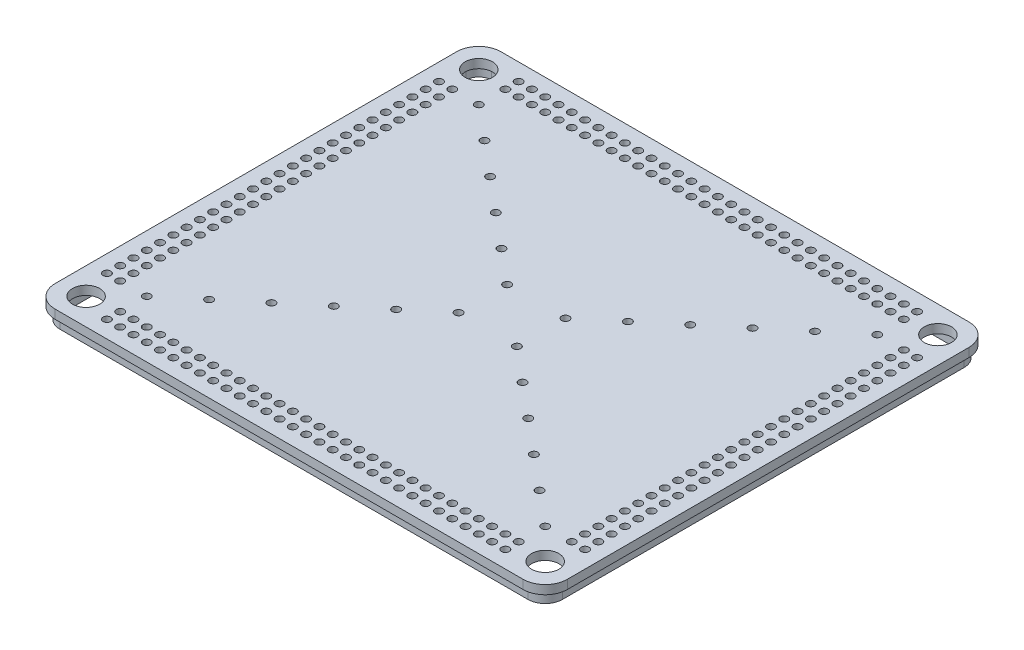
from build123d import *

# Parameters (mm, degrees)
SKETCH1_W               = 231.4
SKETCH1_H               = 201.4
BOSS_EXTRUDE1_DEPTH     = 4
FILLET1_R               = 10
SKETCH2_R               = 6.15
CUT_EXTRUDE1_DEPTH      = 5
MIRROR2_COPY_1_SKETCH_R = 6.15
MIRROR2_COPY_1_DEPTH    = 5
CUT_EXTRUDE2_OUTLINE_R  = 1.75
CUT_EXTRUDE2_DEPTH      = 4
BOSS_EXTRUDE2_DEPTH     = 5
SKETCH6_R               = 1.75
CUT_EXTRUDE4_DEPTH      = 5
SKETCH7_R               = 1.75
CUT_EXTRUDE5_DEPTH      = 10
SKETCH8_R               = 1.75
CUT_EXTRUDE6_DEPTH      = 10


# Read off the part's stored shape, not the designer's step: Cut-Extrude2
with BuildPart() as part:
    # Sketch1 → Boss-Extrude1 (new body)
    with BuildSketch(Plane(origin=(0, 0, 0), x_dir=(1, 0, 0), z_dir=(0, 1, 0))):
        Rectangle(SKETCH1_W, SKETCH1_H)
    extrude(amount=BOSS_EXTRUDE1_DEPTH)

    # Fillet1
    fillet1_edges = [part.edges().sort_by_distance(p)[0] for p in [
        (-115.7, 2, -100.7),
        (115.7, 2, -100.7),
        (115.7, 2, 100.7),
        (-115.7, 2, 100.7),
    ]]
    fillet(fillet1_edges, radius=FILLET1_R)

    # Sketch2 → Cut-Extrude1 (cut)
    with BuildSketch(Plane(origin=(0, 4, 0), x_dir=(1, 0, 0), z_dir=(0, 1, 0))):
        with Locations(Location((-103.7, 88.7, 0), (0, 0, 270))):
            Circle(SKETCH2_R)
    cut_extrude1 = extrude(amount=-CUT_EXTRUDE1_DEPTH, mode=Mode.SUBTRACT)

    # Mirror1: Cut-Extrude1 across plane
    add(cut_extrude1.mirror(Plane(origin=(0, 0, 0), x_dir=(0, 0, 1), z_dir=(1, 0, 0))), mode=Mode.SUBTRACT)

    # Mirror2: Cut-Extrude1 across plane
    add(cut_extrude1.mirror(Plane.XY), mode=Mode.SUBTRACT)

    # Mirror2 copy 1 sketch → Mirror2 copy 1 (cut)
    with BuildSketch(Plane(origin=(0, 4, 0), x_dir=(-1, 0, 0), z_dir=(0, 1, 0))):
        with Locations(Location((-103.7, 88.7, 0), (0, 0, 270))):
            Circle(MIRROR2_COPY_1_SKETCH_R)
    extrude(amount=-MIRROR2_COPY_1_DEPTH, mode=Mode.SUBTRACT)

    # Cut-Extrude2 outline → Cut-Extrude2 (cut)
    with BuildSketch(Plane(origin=(0, 0, 0), x_dir=(1, 0, 0), z_dir=(0, 1, 0))):
        with Locations((-90, 93)):
            Circle(CUT_EXTRUDE2_OUTLINE_R)
        with Locations((24, -93)):
            Circle(CUT_EXTRUDE2_OUTLINE_R)
        with Locations((18, -93)):
            Circle(CUT_EXTRUDE2_OUTLINE_R)
        with Locations((12, -93)):
            Circle(CUT_EXTRUDE2_OUTLINE_R)
        with Locations((6, -93)):
            Circle(CUT_EXTRUDE2_OUTLINE_R)
        with Locations((0, -93)):
            Circle(CUT_EXTRUDE2_OUTLINE_R)
        with Locations((-6, -93)):
            Circle(CUT_EXTRUDE2_OUTLINE_R)
        with Locations((-12, -93)):
            Circle(CUT_EXTRUDE2_OUTLINE_R)
        with Locations((-18, -93)):
            Circle(CUT_EXTRUDE2_OUTLINE_R)
        with Locations((-24, -93)):
            Circle(CUT_EXTRUDE2_OUTLINE_R)
        with Locations((-30, -93)):
            Circle(CUT_EXTRUDE2_OUTLINE_R)
        with Locations((-36, -93)):
            Circle(CUT_EXTRUDE2_OUTLINE_R)
        with Locations((-42, -93)):
            Circle(CUT_EXTRUDE2_OUTLINE_R)
        with Locations((-48, -93)):
            Circle(CUT_EXTRUDE2_OUTLINE_R)
        with Locations((-54, -93)):
            Circle(CUT_EXTRUDE2_OUTLINE_R)
        with Locations((-60, -93)):
            Circle(CUT_EXTRUDE2_OUTLINE_R)
        with Locations((-66, -93)):
            Circle(CUT_EXTRUDE2_OUTLINE_R)
        with Locations((-6, -87)):
            Circle(CUT_EXTRUDE2_OUTLINE_R)
        with Locations((0, -87)):
            Circle(CUT_EXTRUDE2_OUTLINE_R)
        with Locations((6, -87)):
            Circle(CUT_EXTRUDE2_OUTLINE_R)
        with Locations((12, -87)):
            Circle(CUT_EXTRUDE2_OUTLINE_R)
        with Locations((18, -87)):
            Circle(CUT_EXTRUDE2_OUTLINE_R)
        with Locations((24, -87)):
            Circle(CUT_EXTRUDE2_OUTLINE_R)
        with Locations((30, -87)):
            Circle(CUT_EXTRUDE2_OUTLINE_R)
        with Locations((36, -87)):
            Circle(CUT_EXTRUDE2_OUTLINE_R)
        with Locations((42, -87)):
            Circle(CUT_EXTRUDE2_OUTLINE_R)
        with Locations((48, -87)):
            Circle(CUT_EXTRUDE2_OUTLINE_R)
        with Locations((54, -87)):
            Circle(CUT_EXTRUDE2_OUTLINE_R)
        with Locations((60, -87)):
            Circle(CUT_EXTRUDE2_OUTLINE_R)
        with Locations((-90, -87)):
            Circle(CUT_EXTRUDE2_OUTLINE_R)
        with Locations((-84, -93)):
            Circle(CUT_EXTRUDE2_OUTLINE_R)
        with Locations((-78, -93)):
            Circle(CUT_EXTRUDE2_OUTLINE_R)
        with Locations((-72, -93)):
            Circle(CUT_EXTRUDE2_OUTLINE_R)
        with Locations((84, 87)):
            Circle(CUT_EXTRUDE2_OUTLINE_R)
        with Locations((84, -87)):
            Circle(CUT_EXTRUDE2_OUTLINE_R)
        with Locations((84, -93)):
            Circle(CUT_EXTRUDE2_OUTLINE_R)
        with Locations((90, 93)):
            Circle(CUT_EXTRUDE2_OUTLINE_R)
        with Locations((78, 87)):
            Circle(CUT_EXTRUDE2_OUTLINE_R)
        with Locations((78, -87)):
            Circle(CUT_EXTRUDE2_OUTLINE_R)
        with Locations((78, -93)):
            Circle(CUT_EXTRUDE2_OUTLINE_R)
        with Locations((84, 93)):
            Circle(CUT_EXTRUDE2_OUTLINE_R)
        with Locations((90, 87)):
            Circle(CUT_EXTRUDE2_OUTLINE_R)
        with Locations((90, -87)):
            Circle(CUT_EXTRUDE2_OUTLINE_R)
        with Locations((90, -93)):
            Circle(CUT_EXTRUDE2_OUTLINE_R)
        with Locations((54, -93)):
            Circle(CUT_EXTRUDE2_OUTLINE_R)
        with Locations((60, -93)):
            Circle(CUT_EXTRUDE2_OUTLINE_R)
        with Locations((-90, -93)):
            Circle(CUT_EXTRUDE2_OUTLINE_R)
        with Locations((66, 93)):
            Circle(CUT_EXTRUDE2_OUTLINE_R)
        with Locations((48, -93)):
            Circle(CUT_EXTRUDE2_OUTLINE_R)
        with Locations((42, -93)):
            Circle(CUT_EXTRUDE2_OUTLINE_R)
        with Locations((36, -93)):
            Circle(CUT_EXTRUDE2_OUTLINE_R)
        with Locations((30, -93)):
            Circle(CUT_EXTRUDE2_OUTLINE_R)
        with Locations((72, 87)):
            Circle(CUT_EXTRUDE2_OUTLINE_R)
        with Locations((72, -87)):
            Circle(CUT_EXTRUDE2_OUTLINE_R)
        with Locations((72, -93)):
            Circle(CUT_EXTRUDE2_OUTLINE_R)
        with Locations((78, 93)):
            Circle(CUT_EXTRUDE2_OUTLINE_R)
        with Locations((66, 87)):
            Circle(CUT_EXTRUDE2_OUTLINE_R)
        with Locations((66, -87)):
            Circle(CUT_EXTRUDE2_OUTLINE_R)
        with Locations((66, -93)):
            Circle(CUT_EXTRUDE2_OUTLINE_R)
        with Locations((72, 93)):
            Circle(CUT_EXTRUDE2_OUTLINE_R)
        with Locations((-42, 87)):
            Circle(CUT_EXTRUDE2_OUTLINE_R)
        with Locations((-48, 87)):
            Circle(CUT_EXTRUDE2_OUTLINE_R)
        with Locations((-54, 87)):
            Circle(CUT_EXTRUDE2_OUTLINE_R)
        with Locations((-60, 87)):
            Circle(CUT_EXTRUDE2_OUTLINE_R)
        with Locations((-66, 87)):
            Circle(CUT_EXTRUDE2_OUTLINE_R)
        with Locations((-72, 87)):
            Circle(CUT_EXTRUDE2_OUTLINE_R)
        with Locations((-78, 87)):
            Circle(CUT_EXTRUDE2_OUTLINE_R)
        with Locations((-84, 87)):
            Circle(CUT_EXTRUDE2_OUTLINE_R)
        with Locations((54, 93)):
            Circle(CUT_EXTRUDE2_OUTLINE_R)
        with Locations((48, 93)):
            Circle(CUT_EXTRUDE2_OUTLINE_R)
        with Locations((42, 93)):
            Circle(CUT_EXTRUDE2_OUTLINE_R)
        with Locations((36, 93)):
            Circle(CUT_EXTRUDE2_OUTLINE_R)
        with Locations((30, 93)):
            Circle(CUT_EXTRUDE2_OUTLINE_R)
        with Locations((24, 93)):
            Circle(CUT_EXTRUDE2_OUTLINE_R)
        with Locations((18, 93)):
            Circle(CUT_EXTRUDE2_OUTLINE_R)
        with Locations((12, 93)):
            Circle(CUT_EXTRUDE2_OUTLINE_R)
        with Locations((6, 93)):
            Circle(CUT_EXTRUDE2_OUTLINE_R)
        with Locations((0, 93)):
            Circle(CUT_EXTRUDE2_OUTLINE_R)
        with Locations((-6, 93)):
            Circle(CUT_EXTRUDE2_OUTLINE_R)
        with Locations((-12, 93)):
            Circle(CUT_EXTRUDE2_OUTLINE_R)
        with Locations((-18, 93)):
            Circle(CUT_EXTRUDE2_OUTLINE_R)
        with Locations((-24, 93)):
            Circle(CUT_EXTRUDE2_OUTLINE_R)
        with Locations((-30, 93)):
            Circle(CUT_EXTRUDE2_OUTLINE_R)
        with Locations((-36, 93)):
            Circle(CUT_EXTRUDE2_OUTLINE_R)
        with Locations((-42, 93)):
            Circle(CUT_EXTRUDE2_OUTLINE_R)
        with Locations((-48, 93)):
            Circle(CUT_EXTRUDE2_OUTLINE_R)
        with Locations((-54, 93)):
            Circle(CUT_EXTRUDE2_OUTLINE_R)
        with Locations((-60, 93)):
            Circle(CUT_EXTRUDE2_OUTLINE_R)
        with Locations((-66, 93)):
            Circle(CUT_EXTRUDE2_OUTLINE_R)
        with Locations((-72, 93)):
            Circle(CUT_EXTRUDE2_OUTLINE_R)
        with Locations((-78, 93)):
            Circle(CUT_EXTRUDE2_OUTLINE_R)
        with Locations((-84, 93)):
            Circle(CUT_EXTRUDE2_OUTLINE_R)
        with Locations((-60, -87)):
            Circle(CUT_EXTRUDE2_OUTLINE_R)
        with Locations((-66, -87)):
            Circle(CUT_EXTRUDE2_OUTLINE_R)
        with Locations((-72, -87)):
            Circle(CUT_EXTRUDE2_OUTLINE_R)
        with Locations((-78, -87)):
            Circle(CUT_EXTRUDE2_OUTLINE_R)
        with Locations((-84, -87)):
            Circle(CUT_EXTRUDE2_OUTLINE_R)
        with Locations((-90, 87)):
            Circle(CUT_EXTRUDE2_OUTLINE_R)
        with Locations((60, 87)):
            Circle(CUT_EXTRUDE2_OUTLINE_R)
        with Locations((60, 93)):
            Circle(CUT_EXTRUDE2_OUTLINE_R)
        with Locations((-54, -87)):
            Circle(CUT_EXTRUDE2_OUTLINE_R)
        with Locations((-48, -87)):
            Circle(CUT_EXTRUDE2_OUTLINE_R)
        with Locations((-42, -87)):
            Circle(CUT_EXTRUDE2_OUTLINE_R)
        with Locations((-36, -87)):
            Circle(CUT_EXTRUDE2_OUTLINE_R)
        with Locations((-30, -87)):
            Circle(CUT_EXTRUDE2_OUTLINE_R)
        with Locations((-24, -87)):
            Circle(CUT_EXTRUDE2_OUTLINE_R)
        with Locations((-18, -87)):
            Circle(CUT_EXTRUDE2_OUTLINE_R)
        with Locations((-12, -87)):
            Circle(CUT_EXTRUDE2_OUTLINE_R)
        with Locations((54, 87)):
            Circle(CUT_EXTRUDE2_OUTLINE_R)
        with Locations((48, 87)):
            Circle(CUT_EXTRUDE2_OUTLINE_R)
        with Locations((42, 87)):
            Circle(CUT_EXTRUDE2_OUTLINE_R)
        with Locations((36, 87)):
            Circle(CUT_EXTRUDE2_OUTLINE_R)
        with Locations((30, 87)):
            Circle(CUT_EXTRUDE2_OUTLINE_R)
        with Locations((24, 87)):
            Circle(CUT_EXTRUDE2_OUTLINE_R)
        with Locations((18, 87)):
            Circle(CUT_EXTRUDE2_OUTLINE_R)
        with Locations((12, 87)):
            Circle(CUT_EXTRUDE2_OUTLINE_R)
        with Locations((6, 87)):
            Circle(CUT_EXTRUDE2_OUTLINE_R)
        with Locations((0, 87)):
            Circle(CUT_EXTRUDE2_OUTLINE_R)
        with Locations((-6, 87)):
            Circle(CUT_EXTRUDE2_OUTLINE_R)
        with Locations((-12, 87)):
            Circle(CUT_EXTRUDE2_OUTLINE_R)
        with Locations((-18, 87)):
            Circle(CUT_EXTRUDE2_OUTLINE_R)
        with Locations((-24, 87)):
            Circle(CUT_EXTRUDE2_OUTLINE_R)
        with Locations((-30, 87)):
            Circle(CUT_EXTRUDE2_OUTLINE_R)
        with Locations((-36, 87)):
            Circle(CUT_EXTRUDE2_OUTLINE_R)
    extrude(amount=CUT_EXTRUDE2_DEPTH, mode=Mode.SUBTRACT)

    # Sketch5 → Boss-Extrude2 (add)
    with BuildSketch(Plane.XZ):
        with BuildLine():
            Line((-105.7, -98.5), (105.7, -98.5))
            ThreePointArc((105.7, -98.5), (111.215432893, -96.215432893), (113.5, -90.7))
            Line((113.5, -90.7), (113.5, 90.7))
            ThreePointArc((113.5, 90.7), (111.215432893, 96.215432893), (105.7, 98.5))
            Line((105.7, 98.5), (-105.7, 98.5))
            ThreePointArc((-105.7, 98.5), (-111.215432893, 96.215432893), (-113.5, 90.7))
            Line((-113.5, 90.7), (-113.5, -90.7))
            ThreePointArc((-113.5, -90.7), (-111.215432893, -96.215432893), (-105.7, -98.5))
        make_face()
        with BuildLine():
            Line((-105.7, -96.5), (105.7, -96.5))
            ThreePointArc((105.7, -96.5), (109.801219331, -94.801219331), (111.5, -90.7))
            Line((111.5, -90.7), (111.5, 90.7))
            ThreePointArc((111.5, 90.7), (109.801219331, 94.801219331), (105.7, 96.5))
            Line((105.7, 96.5), (-105.7, 96.5))
            ThreePointArc((-105.7, 96.5), (-109.801219331, 94.801219331), (-111.5, 90.7))
            Line((-111.5, 90.7), (-111.5, -90.7))
            ThreePointArc((-111.5, -90.7), (-109.801219331, -94.801219331), (-105.7, -96.5))
        make_face(mode=Mode.SUBTRACT)
    extrude(amount=BOSS_EXTRUDE2_DEPTH)

    # Sketch6 → Cut-Extrude4 (cut)
    with BuildSketch(Plane(origin=(0, 4, 0), x_dir=(1, 0, 0), z_dir=(0, 1, 0))):
        with Locations(Location((-102, 75, 0), (0, 0, 270))):
            Circle(SKETCH6_R)
        with Locations(Location((-108, 75, 0), (0, 0, 270))):
            Circle(SKETCH6_R)
        with Locations(Location((-102, 69, 0), (0, 0, 270))):
            Circle(SKETCH6_R)
        with Locations(Location((-108, 69, 0), (0, 0, 270))):
            Circle(SKETCH6_R)
        with Locations(Location((-102, 63, 0), (0, 0, 270))):
            Circle(SKETCH6_R)
        with Locations(Location((-108, 63, 0), (0, 0, 270))):
            Circle(SKETCH6_R)
        with Locations(Location((-102, 57, 0), (0, 0, 270))):
            Circle(SKETCH6_R)
        with Locations(Location((-108, 57, 0), (0, 0, 270))):
            Circle(SKETCH6_R)
        with Locations(Location((-102, 51, 0), (0, 0, 270))):
            Circle(SKETCH6_R)
        with Locations(Location((-108, 51, 0), (0, 0, 270))):
            Circle(SKETCH6_R)
        with Locations(Location((-102, 45, 0), (0, 0, 270))):
            Circle(SKETCH6_R)
        with Locations(Location((-108, 45, 0), (0, 0, 270))):
            Circle(SKETCH6_R)
        with Locations(Location((-102, 39, 0), (0, 0, 270))):
            Circle(SKETCH6_R)
        with Locations(Location((-108, 39, 0), (0, 0, 270))):
            Circle(SKETCH6_R)
        with Locations(Location((-102, 33, 0), (0, 0, 270))):
            Circle(SKETCH6_R)
        with Locations(Location((-108, 33, 0), (0, 0, 270))):
            Circle(SKETCH6_R)
        with Locations(Location((-102, 27, 0), (0, 0, 270))):
            Circle(SKETCH6_R)
        with Locations(Location((-108, 27, 0), (0, 0, 270))):
            Circle(SKETCH6_R)
        with Locations(Location((-102, 21, 0), (0, 0, 270))):
            Circle(SKETCH6_R)
        with Locations(Location((-108, 21, 0), (0, 0, 270))):
            Circle(SKETCH6_R)
        with Locations(Location((-102, 15, 0), (0, 0, 270))):
            Circle(SKETCH6_R)
        with Locations(Location((-108, 15, 0), (0, 0, 270))):
            Circle(SKETCH6_R)
        with Locations(Location((-102, 9, 0), (0, 0, 270))):
            Circle(SKETCH6_R)
        with Locations(Location((-108, 9, 0), (0, 0, 270))):
            Circle(SKETCH6_R)
        with Locations(Location((-102, 3, 0), (0, 0, 270))):
            Circle(SKETCH6_R)
        with Locations(Location((-108, 3, 0), (0, 0, 270))):
            Circle(SKETCH6_R)
        with Locations(Location((-102, -3, 0), (0, 0, 270))):
            Circle(SKETCH6_R)
        with Locations(Location((-108, -3, 0), (0, 0, 270))):
            Circle(SKETCH6_R)
        with Locations(Location((-102, -9, 0), (0, 0, 270))):
            Circle(SKETCH6_R)
        with Locations(Location((-108, -9, 0), (0, 0, 270))):
            Circle(SKETCH6_R)
        with Locations(Location((-102, -15, 0), (0, 0, 270))):
            Circle(SKETCH6_R)
        with Locations(Location((-108, -15, 0), (0, 0, 270))):
            Circle(SKETCH6_R)
        with Locations(Location((-102, -21, 0), (0, 0, 270))):
            Circle(SKETCH6_R)
        with Locations(Location((-108, -21, 0), (0, 0, 270))):
            Circle(SKETCH6_R)
        with Locations(Location((-102, -27, 0), (0, 0, 270))):
            Circle(SKETCH6_R)
        with Locations(Location((-108, -27, 0), (0, 0, 270))):
            Circle(SKETCH6_R)
        with Locations(Location((-102, -33, 0), (0, 0, 270))):
            Circle(SKETCH6_R)
        with Locations(Location((-108, -33, 0), (0, 0, 270))):
            Circle(SKETCH6_R)
        with Locations(Location((-102, -39, 0), (0, 0, 270))):
            Circle(SKETCH6_R)
        with Locations(Location((-108, -39, 0), (0, 0, 270))):
            Circle(SKETCH6_R)
        with Locations(Location((-102, -45, 0), (0, 0, 270))):
            Circle(SKETCH6_R)
        with Locations(Location((-108, -45, 0), (0, 0, 270))):
            Circle(SKETCH6_R)
        with Locations(Location((-102, -51, 0), (0, 0, 270))):
            Circle(SKETCH6_R)
        with Locations(Location((-108, -51, 0), (0, 0, 270))):
            Circle(SKETCH6_R)
        with Locations(Location((-102, -57, 0), (0, 0, 270))):
            Circle(SKETCH6_R)
        with Locations(Location((-108, -57, 0), (0, 0, 270))):
            Circle(SKETCH6_R)
        with Locations(Location((-102, -63, 0), (0, 0, 270))):
            Circle(SKETCH6_R)
        with Locations(Location((-108, -63, 0), (0, 0, 270))):
            Circle(SKETCH6_R)
        with Locations(Location((-102, -69, 0), (0, 0, 270))):
            Circle(SKETCH6_R)
        with Locations(Location((-108, -69, 0), (0, 0, 270))):
            Circle(SKETCH6_R)
        with Locations(Location((-102, -75, 0), (0, 0, 270))):
            Circle(SKETCH6_R)
        with Locations(Location((-108, -75, 0), (0, 0, 270))):
            Circle(SKETCH6_R)
        with Locations(Location((108, -75, 0), (0, 0, 270))):
            Circle(SKETCH6_R)
        with Locations(Location((102, -75, 0), (0, 0, 270))):
            Circle(SKETCH6_R)
        with Locations(Location((108, -69, 0), (0, 0, 270))):
            Circle(SKETCH6_R)
        with Locations(Location((102, -69, 0), (0, 0, 270))):
            Circle(SKETCH6_R)
        with Locations(Location((108, -63, 0), (0, 0, 270))):
            Circle(SKETCH6_R)
        with Locations(Location((102, -63, 0), (0, 0, 270))):
            Circle(SKETCH6_R)
        with Locations(Location((108, -57, 0), (0, 0, 270))):
            Circle(SKETCH6_R)
        with Locations(Location((102, -57, 0), (0, 0, 270))):
            Circle(SKETCH6_R)
        with Locations(Location((108, -51, 0), (0, 0, 270))):
            Circle(SKETCH6_R)
        with Locations(Location((102, -51, 0), (0, 0, 270))):
            Circle(SKETCH6_R)
        with Locations(Location((108, -45, 0), (0, 0, 270))):
            Circle(SKETCH6_R)
        with Locations(Location((102, -45, 0), (0, 0, 270))):
            Circle(SKETCH6_R)
        with Locations(Location((108, -39, 0), (0, 0, 270))):
            Circle(SKETCH6_R)
        with Locations(Location((102, -39, 0), (0, 0, 270))):
            Circle(SKETCH6_R)
        with Locations(Location((108, -33, 0), (0, 0, 270))):
            Circle(SKETCH6_R)
        with Locations(Location((102, -33, 0), (0, 0, 270))):
            Circle(SKETCH6_R)
        with Locations(Location((108, -27, 0), (0, 0, 270))):
            Circle(SKETCH6_R)
        with Locations(Location((102, -27, 0), (0, 0, 270))):
            Circle(SKETCH6_R)
        with Locations(Location((108, -21, 0), (0, 0, 270))):
            Circle(SKETCH6_R)
        with Locations(Location((102, -21, 0), (0, 0, 270))):
            Circle(SKETCH6_R)
        with Locations(Location((108, -15, 0), (0, 0, 270))):
            Circle(SKETCH6_R)
        with Locations(Location((102, -15, 0), (0, 0, 270))):
            Circle(SKETCH6_R)
        with Locations(Location((108, -9, 0), (0, 0, 270))):
            Circle(SKETCH6_R)
        with Locations(Location((102, -9, 0), (0, 0, 270))):
            Circle(SKETCH6_R)
        with Locations(Location((108, -3, 0), (0, 0, 270))):
            Circle(SKETCH6_R)
        with Locations(Location((102, -3, 0), (0, 0, 270))):
            Circle(SKETCH6_R)
        with Locations(Location((108, 3, 0), (0, 0, 270))):
            Circle(SKETCH6_R)
        with Locations(Location((102, 3, 0), (0, 0, 270))):
            Circle(SKETCH6_R)
        with Locations(Location((108, 9, 0), (0, 0, 270))):
            Circle(SKETCH6_R)
        with Locations(Location((102, 9, 0), (0, 0, 270))):
            Circle(SKETCH6_R)
        with Locations(Location((108, 15, 0), (0, 0, 270))):
            Circle(SKETCH6_R)
        with Locations(Location((102, 15, 0), (0, 0, 270))):
            Circle(SKETCH6_R)
        with Locations(Location((108, 21, 0), (0, 0, 270))):
            Circle(SKETCH6_R)
        with Locations(Location((102, 21, 0), (0, 0, 270))):
            Circle(SKETCH6_R)
        with Locations(Location((108, 27, 0), (0, 0, 270))):
            Circle(SKETCH6_R)
        with Locations(Location((102, 27, 0), (0, 0, 270))):
            Circle(SKETCH6_R)
        with Locations(Location((108, 33, 0), (0, 0, 270))):
            Circle(SKETCH6_R)
        with Locations(Location((102, 33, 0), (0, 0, 270))):
            Circle(SKETCH6_R)
        with Locations(Location((108, 39, 0), (0, 0, 270))):
            Circle(SKETCH6_R)
        with Locations(Location((102, 39, 0), (0, 0, 270))):
            Circle(SKETCH6_R)
        with Locations(Location((108, 45, 0), (0, 0, 270))):
            Circle(SKETCH6_R)
        with Locations(Location((102, 45, 0), (0, 0, 270))):
            Circle(SKETCH6_R)
        with Locations(Location((108, 51, 0), (0, 0, 270))):
            Circle(SKETCH6_R)
        with Locations(Location((102, 51, 0), (0, 0, 270))):
            Circle(SKETCH6_R)
        with Locations(Location((108, 57, 0), (0, 0, 270))):
            Circle(SKETCH6_R)
        with Locations(Location((102, 57, 0), (0, 0, 270))):
            Circle(SKETCH6_R)
        with Locations(Location((108, 63, 0), (0, 0, 270))):
            Circle(SKETCH6_R)
        with Locations(Location((102, 63, 0), (0, 0, 270))):
            Circle(SKETCH6_R)
        with Locations(Location((108, 69, 0), (0, 0, 270))):
            Circle(SKETCH6_R)
        with Locations(Location((102, 69, 0), (0, 0, 270))):
            Circle(SKETCH6_R)
        with Locations(Location((108, 75, 0), (0, 0, 270))):
            Circle(SKETCH6_R)
        with Locations(Location((102, 75, 0), (0, 0, 270))):
            Circle(SKETCH6_R)
    extrude(amount=-CUT_EXTRUDE4_DEPTH, mode=Mode.SUBTRACT)

    # Sketch7 → Cut-Extrude5 (cut)
    with BuildSketch(Plane(origin=(0, 4, 0), x_dir=(1, 0, 0), z_dir=(0, 1, 0))):
        with Locations(Location((-90, -75, 0), (0, 0, 270))):
            Circle(SKETCH7_R)
        with Locations(Location((-90, 75, 0), (0, 0, 270))):
            Circle(SKETCH7_R)
        with Locations(Location((90, 75, 0), (0, 0, 270))):
            Circle(SKETCH7_R)
        with Locations(Location((90, -75, 0), (0, 0, 270))):
            Circle(SKETCH7_R)
    extrude(amount=-CUT_EXTRUDE5_DEPTH, mode=Mode.SUBTRACT)

    # Sketch8 → Cut-Extrude6 (cut)
    with BuildSketch(Plane(origin=(0, 4, 0), x_dir=(1, 0, 0), z_dir=(0, 1, 0))):
        with Locations(Location((-74.635574408, 62.196312007, 0), (0, 0, 270))):
            Circle(SKETCH8_R)
        with Locations(Location((-59.271148816, 49.392624013, 0), (0, 0, 270))):
            Circle(SKETCH8_R)
        with Locations(Location((-43.906723224, 36.58893602, 0), (0, 0, 270))):
            Circle(SKETCH8_R)
        with Locations(Location((-28.542297632, 23.785248027, 0), (0, 0, 270))):
            Circle(SKETCH8_R)
        with Locations(Location((-13.17787204, 10.981560034, 0), (0, 0, 270))):
            Circle(SKETCH8_R)
        with Locations(Location((13.17787204, 10.981560034, 0), (0, 0, 270))):
            Circle(SKETCH8_R)
        with Locations(Location((28.542297632, 23.785248027, 0), (0, 0, 270))):
            Circle(SKETCH8_R)
        with Locations(Location((43.906723224, 36.58893602, 0), (0, 0, 270))):
            Circle(SKETCH8_R)
        with Locations(Location((59.271148816, 49.392624013, 0), (0, 0, 270))):
            Circle(SKETCH8_R)
        with Locations(Location((74.635574408, 62.196312007, 0), (0, 0, 270))):
            Circle(SKETCH8_R)
        with Locations(Location((74.635574408, -62.196312007, 0), (0, 0, 270))):
            Circle(SKETCH8_R)
        with Locations(Location((59.271148816, -49.392624013, 0), (0, 0, 270))):
            Circle(SKETCH8_R)
        with Locations(Location((43.906723224, -36.58893602, 0), (0, 0, 270))):
            Circle(SKETCH8_R)
        with Locations(Location((28.542297632, -23.785248027, 0), (0, 0, 270))):
            Circle(SKETCH8_R)
        with Locations(Location((13.17787204, -10.981560034, 0), (0, 0, 270))):
            Circle(SKETCH8_R)
        with Locations(Location((-13.17787204, -10.981560034, 0), (0, 0, 270))):
            Circle(SKETCH8_R)
        with Locations(Location((-28.542297632, -23.785248027, 0), (0, 0, 270))):
            Circle(SKETCH8_R)
        with Locations(Location((-43.906723224, -36.58893602, 0), (0, 0, 270))):
            Circle(SKETCH8_R)
        with Locations(Location((-59.271148816, -49.392624013, 0), (0, 0, 270))):
            Circle(SKETCH8_R)
        with Locations(Location((-74.635574408, -62.196312007, 0), (0, 0, 270))):
            Circle(SKETCH8_R)
    extrude(amount=-CUT_EXTRUDE6_DEPTH, mode=Mode.SUBTRACT)


solid = part.part
